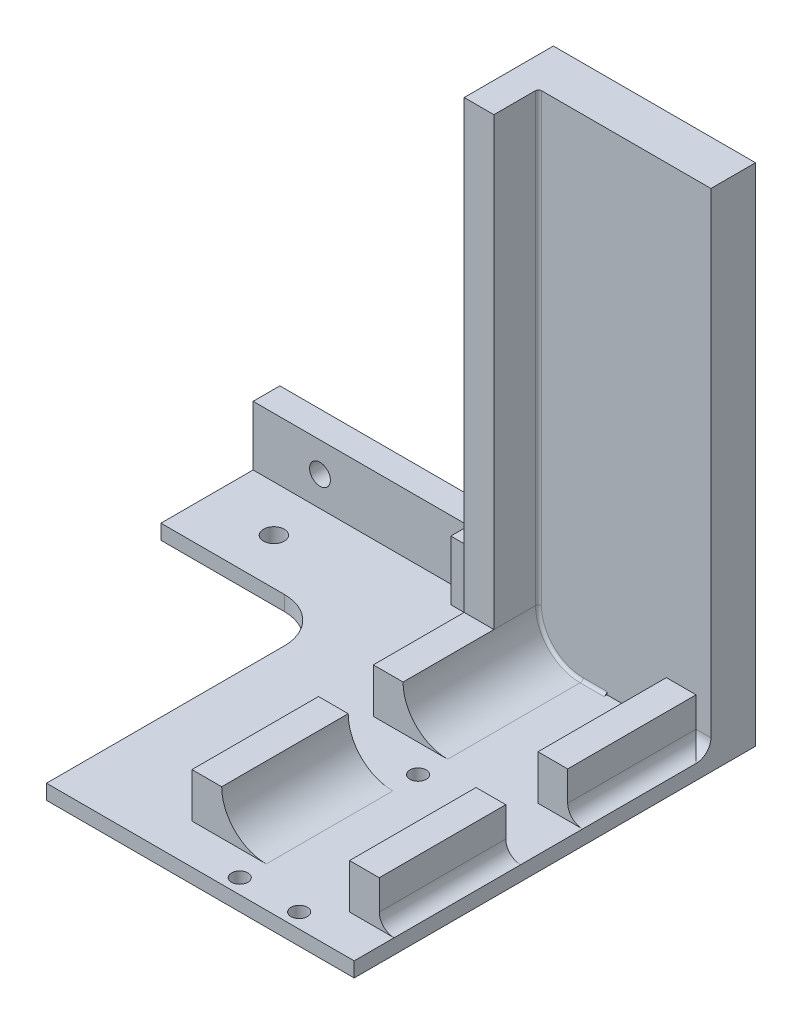
from build123d import *

# Parameters (mm, degrees)
BOSS_EXTRUDE1_DEPTH      = 250
BOSS_EXTRUDE2_DEPTH      = 50
BOSS_EXTRUDE2_2_DEPTH    = 50
LPATTERN1_COUNT          = 4
LPATTERN1_PITCH          = 60
SKETCH2_R                = 2.75
CUT_EXTRUDE1_DEPTH       = 251.864711302
UPPER_ACRYLIC_SUPP_W     = 20
UPPER_ACRYLIC_SUPP_H     = 250
BOSS_EXTRUDE3_DEPTH      = 5
UPPER_ACRYLIC_SUPP_3_W   = 10
UPPER_ACRYLIC_SUPP_3_H   = 66.073604859
UPPER_ACRYLIC_SUPP_3_H_2 = 41.475217291
UPPER_ACRYLIC_SUPP_3_H_3 = 42.557179481
UPPER_ACRYLIC_SUPP_3_H_4 = 45.558340935
BOSS_EXTRUDE4_DEPTH      = 15
FILLET1_R                = 15
SKETCH4_W                = 60
SKETCH4_H                = 15
BOSS_EXTRUDE5_DEPTH      = 5
SKETCH4_3_W              = 60
SKETCH4_3_H              = 15
BOSS_EXTRUDE6_DEPTH      = 60
SKETCH5_W                = 10
SKETCH5_H                = 45
BOSS_EXTRUDE7_DEPTH      = 15
BOSS_EXTRUDE8_START      = 250
SKETCH5_3_W              = 10
SKETCH5_3_H              = 45
BOSS_EXTRUDE8_DEPTH      = 15
FILLET2_R                = 1
SKETCH6_W                = 6
SKETCH6_H                = 60
CUT_EXTRUDE2_DEPTH       = 6
BOSS_EXTRUDE9_DEPTH      = 30
SKETCH8_W                = 333.602701612
SKETCH8_H                = 59.031331047
CUT_EXTRUDE3_DEPTH       = 150
SKETCH9_W                = 6
SKETCH9_H                = 20
CLOTH_ESCAPE_GAP_DEPTH   = 20
SKETCH11_W               = 9
SKETCH11_H               = 20
BOSS_EXTRUDE11_DEPTH     = 100
CUT_EXTRUDE4_DEPTH       = 68
SKETCH13_W               = 40
SKETCH13_H               = 5
BOSS_EXTRUDE13_DEPTH     = 100
CUT_EXTRUDE5_DEPTH       = 100
FILLET3_R                = 15
BOSS_EXTRUDE14_START     = -5
BOSS_EXTRUDE14_DEPTH     = 25
CUT_EXTRUDE6_DEPTH       = 30
CUT_EXTRUDE6_DEPTH_BACK  = 10
SKETCH16_5_W             = 8.5
SKETCH16_5_H             = 41.475217291
SKETCH16_5_H_2           = 42.557179481
SKETCH16_5_W_2           = 1.5
SKETCH16_5_H_3           = 42.177819043
SKETCH16_5_H_4           = 20.831100018
SKETCH16_5_H_5           = 17.311395043
SKETCH16_5_H_6           = 18.573684265
SKETCH16_5_H_7           = 65.073604859
SKETCH16_6_W             = 8.5
SKETCH16_6_H             = 41.475217291
SKETCH16_6_H_2           = 42.557179481
SKETCH16_6_W_2           = 1.5
SKETCH16_6_H_3           = 42.177819043
SKETCH16_6_H_4           = 20.831100018
SKETCH16_6_H_5           = 17.311395043
SKETCH16_6_H_6           = 18.573684265
SKETCH16_6_H_7           = 65.073604859
BOSS_EXTRUDE15_DEPTH     = 5
BOSS_EXTRUDE16_DEPTH     = 20
SKETCH16_8_W             = 8.5
SKETCH16_8_H             = 41.475217291
SKETCH16_8_H_2           = 42.557179481
SKETCH16_8_W_2           = 1.5
SKETCH16_8_H_3           = 42.177819043
SKETCH16_8_H_4           = 65.073604859
BOSS_EXTRUDE17_DEPTH     = 15
BOSS_EXTRUDE18_START     = -5
BOSS_EXTRUDE18_DEPTH     = 25
FILLET4_R                = 5
BOSS_EXTRUDE21_START     = 145
BOSS_EXTRUDE21_DEPTH     = 170
SKETCH19_R               = 3.5
CUT_EXTRUDE7_DEPTH       = 10
CUT_EXTRUDE8_DEPTH       = 355
CUT_EXTRUDE8_DEPTH_BACK  = 10
SKETCH20_R               = 3.5
SKETCH21_W               = 15
SKETCH21_H               = 197.501027769
CUT_EXTRUDE9_DEPTH       = 340
SKETCH22_W               = 160
SKETCH22_H               = 135
SKETCH22_H_2             = 10
CUT_EXTRUDE10_DEPTH      = 217


with BuildPart() as part:
    # profile → Boss-Extrude1 (new body)
    with BuildSketch(Plane.XY):
        Polygon((-14.746446609, 10.353553391), (-5.253553391, 10.353553391), (5.667330529, 10.353553391), (14.746446609, 10.353553391), (20, 10.353553391), (20, 15.353553391), (-20, 15.353553391), (-20, 10.353553391), align=None)
    extrude(amount=BOSS_EXTRUDE1_DEPTH)

    # Sketch2 → Cut-Extrude1 (cut, through all)
    with BuildSketch(Plane.XZ.offset(-10.353553391)):
        with Locations(Location((-10, 175, 0), (0, 0, 270))):
            Circle(SKETCH2_R)
        with Locations(Location((10, 175, 0), (0, 0, 270))):
            Circle(SKETCH2_R)
        with Locations(Location((-10, 115, 0), (0, 0, 270))):
            Circle(SKETCH2_R)
        with Locations(Location((10, 115, 0), (0, 0, 270))):
            Circle(SKETCH2_R)
        with Locations(Location((-10, 55, 0), (0, 0, 270))):
            Circle(SKETCH2_R)
        with Locations(Location((10, 55, 0), (0, 0, 270))):
            Circle(SKETCH2_R)
    extrude(amount=-CUT_EXTRUDE1_DEPTH, mode=Mode.SUBTRACT)

    # upper_acrylic_supp → Boss-Extrude3 (add)
    with BuildSketch(Plane(origin=(0, 15.353553391, 0), x_dir=(1, 0, 0), z_dir=(0, 1, 0))):
        with Locations((-30, -125)):
            Rectangle(UPPER_ACRYLIC_SUPP_W, UPPER_ACRYLIC_SUPP_H)
    extrude(amount=-BOSS_EXTRUDE3_DEPTH)

    # upper_acrylic_supp<3> → Boss-Extrude4 (add)
    with BuildSketch(Plane(origin=(0, 15.353553391, 0), x_dir=(1, 0, 0), z_dir=(0, 1, 0))):
        with Locations((-29.5, -216.963197571)):
            Rectangle(UPPER_ACRYLIC_SUPP_3_W, UPPER_ACRYLIC_SUPP_3_H)
        with Locations((-29.5, -144.615102231)):
            Rectangle(UPPER_ACRYLIC_SUPP_3_W, UPPER_ACRYLIC_SUPP_3_H_2)
        with Locations((-29.5, -85.287508801)):
            Rectangle(UPPER_ACRYLIC_SUPP_3_W, UPPER_ACRYLIC_SUPP_3_H_3)
        with Locations((-29.5, -22.779170468)):
            Rectangle(UPPER_ACRYLIC_SUPP_3_W, UPPER_ACRYLIC_SUPP_3_H_4)
    extrude(amount=BOSS_EXTRUDE4_DEPTH)

    # Fillet1
    fillet1_edges = [part.edges().sort_by_distance(p)[0] for p in [
        (-24.5, 15.353553391, 22.779170467),
        (-24.5, 15.353553391, 85.287508801),
        (-24.5, 15.353553391, 144.615102231),
        (-24.5, 15.353553391, 216.963197571),
    ]]
    fillet(fillet1_edges, radius=FILLET1_R - 0.0001)  # a hair under: the kernel refuses the full size



with BuildPart() as body_2:
    # Sketch1<3> → Boss-Extrude2 (new body)
    with BuildSketch(Plane.XY):
        Polygon((-7.253553391, 8.353553391), (-8.119669914, 7.487436867), (-5.5, 7.487436867), (-4.987436867, 7.487436867), (-5.5, 6.974873734), (-7.874873734, 4.6), (-12.125126266, 4.6), (-14.5, 6.974873734), (-15.012563133, 7.487436867), (-14.5, 7.487436867), (-11.880330086, 7.487436867), (-12.746446609, 8.353553391), (-14.746446609, 10.353553391), (-5.253553391, 10.353553391), align=None)
    boss_extrude2 = extrude(amount=BOSS_EXTRUDE2_DEPTH)


with BuildPart() as body_3:
    # Sketch1<3> → Boss-Extrude2 2 (new body)
    with BuildSketch(Plane.XY):
        Polygon((12.746446609, 8.353553391), (11.880330086, 7.487436867), (14.5, 7.487436867), (15.012563133, 7.487436867), (14.5, 6.974873734), (12.125126266, 4.6), (7.874873734, 4.6), (5.5, 6.974873734), (4.987436867, 7.487436867), (5.5, 7.487436867), (8.533447053, 7.487436867), (7.667330529, 8.353553391), (5.667330529, 10.353553391), (14.746446609, 10.353553391), align=None)
    boss_extrude2_2 = extrude(amount=BOSS_EXTRUDE2_2_DEPTH)


with BuildPart() as lpattern1_1:
    # LPattern1: pattern copy
    add(boss_extrude2.moved(Location(Vector(0, 0, 1) * (1 * LPATTERN1_PITCH))))


with BuildPart() as lpattern1_2:
    # LPattern1: pattern copy
    add(boss_extrude2.moved(Location(Vector(0, 0, 1) * (2 * LPATTERN1_PITCH))))


with BuildPart() as lpattern1_3:
    # LPattern1: pattern copy
    add(boss_extrude2.moved(Location(Vector(0, 0, 1) * (3 * LPATTERN1_PITCH))))


with BuildPart() as lpattern1_4:
    # LPattern1: pattern copy
    add(boss_extrude2_2.moved(Location(Vector(0, 0, 1) * (1 * LPATTERN1_PITCH))))


with BuildPart() as lpattern1_5:
    # LPattern1: pattern copy
    add(boss_extrude2_2.moved(Location(Vector(0, 0, 1) * (2 * LPATTERN1_PITCH))))


with BuildPart() as lpattern1_6:
    # LPattern1: pattern copy
    add(boss_extrude2_2.moved(Location(Vector(0, 0, 1) * (3 * LPATTERN1_PITCH))))


with BuildPart() as part_1:
    add(part.part)

    add(body_2.part)  # Boss-Extrude5 merges body 2

    add(body_3.part)  # Boss-Extrude5 merges body 3
    # Sketch4 → Boss-Extrude5 (add, symmetric)
    with BuildSketch(Plane(origin=(0, 15.353553391, 0), x_dir=(1, 0, 0), z_dir=(0, 1, 0))):
        with Locations((-10, -257.5)):
            Rectangle(SKETCH4_W, SKETCH4_H)
        with Locations((-10, 7.5)):
            Rectangle(SKETCH4_W, SKETCH4_H)
    extrude(amount=BOSS_EXTRUDE5_DEPTH, both=True)

    # Sketch4<3> → Boss-Extrude6 (add)
    with BuildSketch(Plane(origin=(0, 15.353553391, 0), x_dir=(1, 0, 0), z_dir=(0, 1, 0))):
        with Locations((-10, -257.5)):
            Rectangle(SKETCH4_3_W, SKETCH4_3_H)
        with Locations((-10, 7.5)):
            Rectangle(SKETCH4_3_W, SKETCH4_3_H)
    extrude(amount=BOSS_EXTRUDE6_DEPTH)

    # Sketch5 → Boss-Extrude7 (add)
    with BuildSketch(Plane(origin=(0, 0, 250), x_dir=(-1, 0, 0), z_dir=(0, 0, -1))):
        with Locations((29.5, 52.853553391)):
            Rectangle(SKETCH5_W, SKETCH5_H)
    extrude(amount=BOSS_EXTRUDE7_DEPTH)

    # Sketch5<3> → Boss-Extrude8 (add)
    with BuildSketch(Plane(origin=(0, 0, 250), x_dir=(-1, 0, 0), z_dir=(0, 0, -1)).offset(BOSS_EXTRUDE8_START)):
        with Locations((29.5, 52.853553391)):
            Rectangle(SKETCH5_3_W, SKETCH5_3_H)
    extrude(amount=-BOSS_EXTRUDE8_DEPTH)

    # Fillet2
    fillet2_edges = [part_1.edges().sort_by_distance(p)[0] for p in [
        (-24.5, 52.853503391, 250),
        (-24.5, 52.853503391, 0),
        (5.24995, 15.353553391, 250),
        (-20.106631007, 19.746922384, 250),
        (-20.106631007, 19.746922384, 0),
        (5.24995, 15.353553391, 0),
    ]]
    fillet(fillet2_edges, radius=FILLET2_R)

    # Sketch6 → Cut-Extrude2 (cut)
    with BuildSketch(Plane.ZY.offset(40)):
        with Locations((253, 45.353553391)):
            Rectangle(SKETCH6_W, SKETCH6_H)
        with Locations((-3, 45.353553391)):
            Rectangle(SKETCH6_W, SKETCH6_H)
    extrude(amount=-CUT_EXTRUDE2_DEPTH, mode=Mode.SUBTRACT)

    # Sketch7 → Boss-Extrude9 (add)
    with BuildSketch(Plane.ZY.offset(40)):
        Polygon((265, 75.353553391), (256, 75.353553391), (256, 15.353553391), (-6, 15.353553391), (-6, 75.353553391), (-15, 75.353553391), (-15, 10.353553391), (265, 10.353553391), align=None)
    extrude(amount=BOSS_EXTRUDE9_DEPTH)

    # Sketch8 → Cut-Extrude3 (cut)
    with BuildSketch(Plane.ZY.offset(70)):
        with Locations((122.426839416, 64.869218915)):
            Rectangle(SKETCH8_W, SKETCH8_H)
    extrude(amount=-CUT_EXTRUDE3_DEPTH, mode=Mode.SUBTRACT)

    # Sketch9 → cloth_escape_gap (add)
    with BuildSketch(Plane.ZY.offset(34)):
        with Locations((253, 25.353553391)):
            Rectangle(SKETCH9_W, SKETCH9_H)
        with Locations((-3, 25.353553391)):
            Rectangle(SKETCH9_W, SKETCH9_H)
    extrude(amount=CLOTH_ESCAPE_GAP_DEPTH)

    # Sketch11 → Boss-Extrude11 (add)
    with BuildSketch(Plane.ZY.offset(70)):
        with Locations((-10.5, 25.353553391)):
            Rectangle(SKETCH11_W, SKETCH11_H)
        with Locations((260.5, 25.353553391)):
            Rectangle(SKETCH11_W, SKETCH11_H)
    extrude(amount=BOSS_EXTRUDE11_DEPTH)

    # Sketch12 → Cut-Extrude4 (cut)
    with BuildSketch(Plane.XZ.offset(-10.353553391)):
        Polygon((-170, 265), (-70, 265), (-170, 260.5), align=None)
        Polygon((-70, -15), (-170, -10.5), (-170, -15), align=None)
    extrude(amount=-CUT_EXTRUDE4_DEPTH, mode=Mode.SUBTRACT)

    # Sketch13 → Boss-Extrude13 (add)
    with BuildSketch(Plane.ZY.offset(70)):
        with Locations((5, 12.853553391)):
            Rectangle(SKETCH13_W, SKETCH13_H)
        with Locations((245, 12.853553391)):
            Rectangle(SKETCH13_W, SKETCH13_H)
    extrude(amount=BOSS_EXTRUDE13_DEPTH)

    # Sketch14 → Cut-Extrude5 (cut)
    with BuildSketch(Plane(origin=(0, 15.353553391, 0), x_dir=(1, 0, 0), z_dir=(0, 1, 0))):
        Polygon((-70, -265), (-170, -260.5), (-170, -265), align=None)
        Polygon((-170, 15), (-170, 10.5), (-70, 15), align=None)
    extrude(amount=-CUT_EXTRUDE5_DEPTH, mode=Mode.SUBTRACT)

    # Fillet3
    fillet3_edges = [part_1.edges().sort_by_distance(p)[0] for p in [
        (-70, 12.853553391, 25),
        (-70, 12.853553391, 225),
    ]]
    fillet(fillet3_edges, radius=FILLET3_R)

    # Sketch16 → Boss-Extrude14 (add)
    with BuildSketch(Plane(origin=(0, 15.353553391, 0), x_dir=(1, 0, 0), z_dir=(0, 1, 0)).offset(BOSS_EXTRUDE14_START)):
        Polygon((28.5, 0), (33.5, 0), (33.5, 15), (18.5, 15), (18.5, 0), align=None)
        Polygon((18.5, -250), (18.5, -265), (33.5, -265), (33.5, -250), (28.5, -250), align=None)
    extrude(amount=BOSS_EXTRUDE14_DEPTH)

    # Sketch16<5> → Cut-Extrude6 (cut, two sides: drawn at the far end of the back side and taken through both)
    with BuildSketch(Plane(origin=(0, 15.353553391, 0), x_dir=(1, 0, 0), z_dir=(0, 1, 0)).offset(-CUT_EXTRUDE6_DEPTH_BACK)):
        Polygon((18.5, -250), (18.5, -265), (33.5, -265), (33.5, -250), (28.5, -250), align=None)
        Polygon((28.5, -250), (33.5, -250), (33.5, 0), (28.5, 0), (28.5, -43.177819043), (20, -43.177819043), (20, -64.008919061), (28.5, -64.008919061), (28.5, -106.566098542), (20, -106.566098542), (20, -123.877493585), (28.5, -123.877493585), (28.5, -165.352710876), (20, -165.352710876), (20, -183.926395141), (28.5, -183.926395141), align=None)
        with Locations((24.25, -144.615102231)):
            Rectangle(SKETCH16_5_W, SKETCH16_5_H)
        with Locations((24.25, -85.287508801)):
            Rectangle(SKETCH16_5_W, SKETCH16_5_H_2)
        Polygon((28.5, -43.177819043), (28.5, 0), (18.5, 0), (18.5, -1), (20, -1), (20, -43.177819043), align=None)
        Polygon((28.5, 0), (33.5, 0), (33.5, 15), (18.5, 15), (18.5, 0), align=None)
        with Locations((19.25, -22.088909521)):
            Rectangle(SKETCH16_5_W_2, SKETCH16_5_H_3)
        with Locations((19.25, -53.593369052)):
            Rectangle(SKETCH16_5_W_2, SKETCH16_5_H_4)
        with Locations((19.25, -85.287508801)):
            Rectangle(SKETCH16_5_W_2, SKETCH16_5_H_2)
        with Locations((19.25, -115.221796064)):
            Rectangle(SKETCH16_5_W_2, SKETCH16_5_H_5)
        with Locations((19.25, -144.615102231)):
            Rectangle(SKETCH16_5_W_2, SKETCH16_5_H)
        with Locations((19.25, -174.639553009)):
            Rectangle(SKETCH16_5_W_2, SKETCH16_5_H_6)
        with Locations((19.25, -216.463197571)):
            Rectangle(SKETCH16_5_W_2, SKETCH16_5_H_7)
        Polygon((18.5, -249), (18.5, -250), (28.5, -250), (28.5, -183.926395141), (20, -183.926395141), (20, -249), align=None)
    extrude(amount=CUT_EXTRUDE6_DEPTH + CUT_EXTRUDE6_DEPTH_BACK, mode=Mode.SUBTRACT)

    # Sketch16<6> → Boss-Extrude15 (add)
    with BuildSketch(Plane(origin=(0, 15.353553391, 0), x_dir=(1, 0, 0), z_dir=(0, 1, 0))):
        Polygon((28.5, -250), (33.5, -250), (33.5, 0), (28.5, 0), (28.5, -43.177819043), (20, -43.177819043), (20, -64.008919061), (28.5, -64.008919061), (28.5, -106.566098542), (20, -106.566098542), (20, -123.877493585), (28.5, -123.877493585), (28.5, -165.352710876), (20, -165.352710876), (20, -183.926395141), (28.5, -183.926395141), align=None)
        Polygon((18.5, -249), (18.5, -250), (28.5, -250), (28.5, -183.926395141), (20, -183.926395141), (20, -249), align=None)
        Polygon((18.5, -250), (18.5, -265), (33.5, -265), (33.5, -250), (28.5, -250), align=None)
        with Locations((24.25, -144.615102231)):
            Rectangle(SKETCH16_6_W, SKETCH16_6_H)
        with Locations((24.25, -85.287508801)):
            Rectangle(SKETCH16_6_W, SKETCH16_6_H_2)
        Polygon((28.5, -43.177819043), (28.5, 0), (18.5, 0), (18.5, -1), (20, -1), (20, -43.177819043), align=None)
        Polygon((28.5, 0), (33.5, 0), (33.5, 15), (18.5, 15), (18.5, 0), align=None)
        with Locations((19.25, -22.088909521)):
            Rectangle(SKETCH16_6_W_2, SKETCH16_6_H_3)
        with Locations((19.25, -53.593369052)):
            Rectangle(SKETCH16_6_W_2, SKETCH16_6_H_4)
        with Locations((19.25, -85.287508801)):
            Rectangle(SKETCH16_6_W_2, SKETCH16_6_H_2)
        with Locations((19.25, -115.221796064)):
            Rectangle(SKETCH16_6_W_2, SKETCH16_6_H_5)
        with Locations((19.25, -144.615102231)):
            Rectangle(SKETCH16_6_W_2, SKETCH16_6_H)
        with Locations((19.25, -174.639553009)):
            Rectangle(SKETCH16_6_W_2, SKETCH16_6_H_6)
        with Locations((19.25, -216.463197571)):
            Rectangle(SKETCH16_6_W_2, SKETCH16_6_H_7)
    extrude(amount=-BOSS_EXTRUDE15_DEPTH)

    # Sketch16<7> → Boss-Extrude16 (add)
    with BuildSketch(Plane(origin=(0, 15.353553391, 0), x_dir=(1, 0, 0), z_dir=(0, 1, 0))):
        Polygon((18.5, -250), (18.5, -265), (33.5, -265), (33.5, -250), (28.5, -250), align=None)
        Polygon((28.5, 0), (33.5, 0), (33.5, 15), (18.5, 15), (18.5, 0), align=None)
    extrude(amount=BOSS_EXTRUDE16_DEPTH)

    # Sketch16<8> → Boss-Extrude17 (add)
    with BuildSketch(Plane(origin=(0, 15.353553391, 0), x_dir=(1, 0, 0), z_dir=(0, 1, 0))):
        Polygon((18.5, -249), (18.5, -250), (28.5, -250), (28.5, -183.926395141), (20, -183.926395141), (20, -249), align=None)
        with Locations((24.25, -144.615102231)):
            Rectangle(SKETCH16_8_W, SKETCH16_8_H)
        with Locations((24.25, -85.287508801)):
            Rectangle(SKETCH16_8_W, SKETCH16_8_H_2)
        Polygon((28.5, -43.177819043), (28.5, 0), (18.5, 0), (18.5, -1), (20, -1), (20, -43.177819043), align=None)
        with Locations((19.25, -22.088909521)):
            Rectangle(SKETCH16_8_W_2, SKETCH16_8_H_3)
        with Locations((19.25, -85.287508801)):
            Rectangle(SKETCH16_8_W_2, SKETCH16_8_H_2)
        with Locations((19.25, -144.615102231)):
            Rectangle(SKETCH16_8_W_2, SKETCH16_8_H)
        with Locations((19.25, -216.463197571)):
            Rectangle(SKETCH16_8_W_2, SKETCH16_8_H_4)
    extrude(amount=BOSS_EXTRUDE17_DEPTH)

    # Sketch14<2> → Boss-Extrude18 (add)
    with BuildSketch(Plane(origin=(0, 15.353553391, 0), x_dir=(1, 0, 0), z_dir=(0, 1, 0)).offset(BOSS_EXTRUDE18_START)):
        Polygon((-70, -265), (-170, -260.5), (-170, -265), align=None)
        Polygon((-170, 15), (-170, 10.5), (-70, 15), align=None)
    extrude(amount=BOSS_EXTRUDE18_DEPTH)

    # Fillet4
    fillet4_edges = [part_1.edges().sort_by_distance(p)[0] for p in [
        (31, 15.353553391, 0),
        (28.5, 15.353553391, 21.588909521),
        (28.5, 15.353553391, 85.287508801),
        (28.5, 15.353553391, 144.615102231),
        (31, 15.353553391, 250),
        (28.5, 15.353553391, 216.963197571),
    ]]
    fillet(fillet4_edges, radius=FILLET4_R - 0.0001)  # a hair under: the kernel refuses the full size

    # Sketch18 → Boss-Extrude21 (add)
    with BuildSketch(Plane(origin=(0, 35.353553391, 0), x_dir=(1, 0, 0), z_dir=(0, 1, 0)).offset(BOSS_EXTRUDE21_START)):
        with BuildLine():
            Line((-34.5, -250), (-34.5, -265))
            Line((-34.5, -265), (33.5, -265))
            Line((33.5, -265), (33.5, -250))
            Line((33.5, -250), (-23.5, -250))
            ThreePointArc((-23.5, -250), (-24.207106781, -249.707106781), (-24.5, -249))
            Line((-24.5, -249), (-24.5, -235))
            Line((-24.5, -235), (-34.5, -235))
            Line((-34.5, -235), (-34.5, -250))
        make_face()
        with BuildLine():
            Line((-34.5, 15), (-34.5, 0))
            Line((-34.5, 0), (-34.5, -15))
            Line((-34.5, -15), (-24.5, -15))
            Line((-24.5, -15), (-24.5, -1))
            ThreePointArc((-24.5, -1), (-24.207106781, -0.292893219), (-23.5, 0))
            Line((-23.5, 0), (33.5, 0))
            Line((33.5, 0), (33.5, 15))
            Line((33.5, 15), (-34.5, 15))
        make_face()
    extrude(amount=-BOSS_EXTRUDE21_DEPTH)

    # Sketch19 → Cut-Extrude7 (cut)
    with BuildSketch(Plane(origin=(0, 15.353553391, 0), x_dir=(1, 0, 0), z_dir=(0, 1, 0))):
        with Locations(Location((-154, -9.5, 0), (0, 0, 270))):
            Circle(SKETCH19_R)
        with Locations(Location((-104, -9.5, 0), (0, 0, 270))):
            Circle(SKETCH19_R)
        with Locations(Location((-104, -240.5, 0), (0, 0, 270))):
            Circle(SKETCH19_R)
        with Locations(Location((-154, -240.5, 0), (0, 0, 270))):
            Circle(SKETCH19_R)
    extrude(amount=-CUT_EXTRUDE7_DEPTH, mode=Mode.SUBTRACT)

    # Sketch20 → Cut-Extrude8 (cut, two sides: drawn at the far end of the back side and taken through both)
    with BuildSketch(Plane(origin=(0, 0, 256), x_dir=(-1, 0, 0), z_dir=(0, 0, -1)).offset(-CUT_EXTRUDE8_DEPTH_BACK)):
        with Locations(Location((104, 25.353553391, 0), (0, 0, 180))):
            Circle(SKETCH20_R)
        with Locations(Location((154, 25.353553391, 0), (0, 0, 180))):
            Circle(SKETCH20_R)
    extrude(amount=CUT_EXTRUDE8_DEPTH + CUT_EXTRUDE8_DEPTH_BACK, mode=Mode.SUBTRACT)

    # Sketch21 → Cut-Extrude9 (cut)
    with BuildSketch(Plane.XY):
        with Locations((6, 114.104067276)):
            Rectangle(SKETCH21_W, SKETCH21_H)
    extrude(amount=CUT_EXTRUDE9_DEPTH, mode=Mode.SUBTRACT)


with BuildPart() as cut_extrude10_tool:
    # Sketch22 → Cut-Extrude10 (new body)
    with BuildSketch(Plane(origin=(0, 0, 0), x_dir=(1, 0, 0), z_dir=(0, 1, 0))):
        Polygon((-126.5, 15), (-186.5, 15), (-186.5, -265), (-126.5, -265), (-126.5, -130), (-126.5, -120), align=None)
        with Locations((-46.5, -197.5)):
            Rectangle(SKETCH22_W, SKETCH22_H)
        with Locations((-46.5, -125)):
            Rectangle(SKETCH22_W, SKETCH22_H_2)
    extrude(amount=CUT_EXTRUDE10_DEPTH)


with BuildPart() as part_2:
    add(part_1.part)

    # Cut-Extrude10: cut by cut_extrude10_tool
    add(cut_extrude10_tool.part, mode=Mode.SUBTRACT)


with BuildPart() as lpattern1_2_1:
    add(lpattern1_2.part)

    # Cut-Extrude10: cut by cut_extrude10_tool
    add(cut_extrude10_tool.part, mode=Mode.SUBTRACT)


with BuildPart() as lpattern1_3_1:
    add(lpattern1_3.part)

    # Cut-Extrude10: cut by cut_extrude10_tool
    add(cut_extrude10_tool.part, mode=Mode.SUBTRACT)


with BuildPart() as lpattern1_5_1:
    add(lpattern1_5.part)

    # Cut-Extrude10: cut by cut_extrude10_tool
    add(cut_extrude10_tool.part, mode=Mode.SUBTRACT)


with BuildPart() as lpattern1_6_1:
    add(lpattern1_6.part)

    # Cut-Extrude10: cut by cut_extrude10_tool
    add(cut_extrude10_tool.part, mode=Mode.SUBTRACT)


solid = Compound([lpattern1_1.part, lpattern1_4.part, part_2.part])
